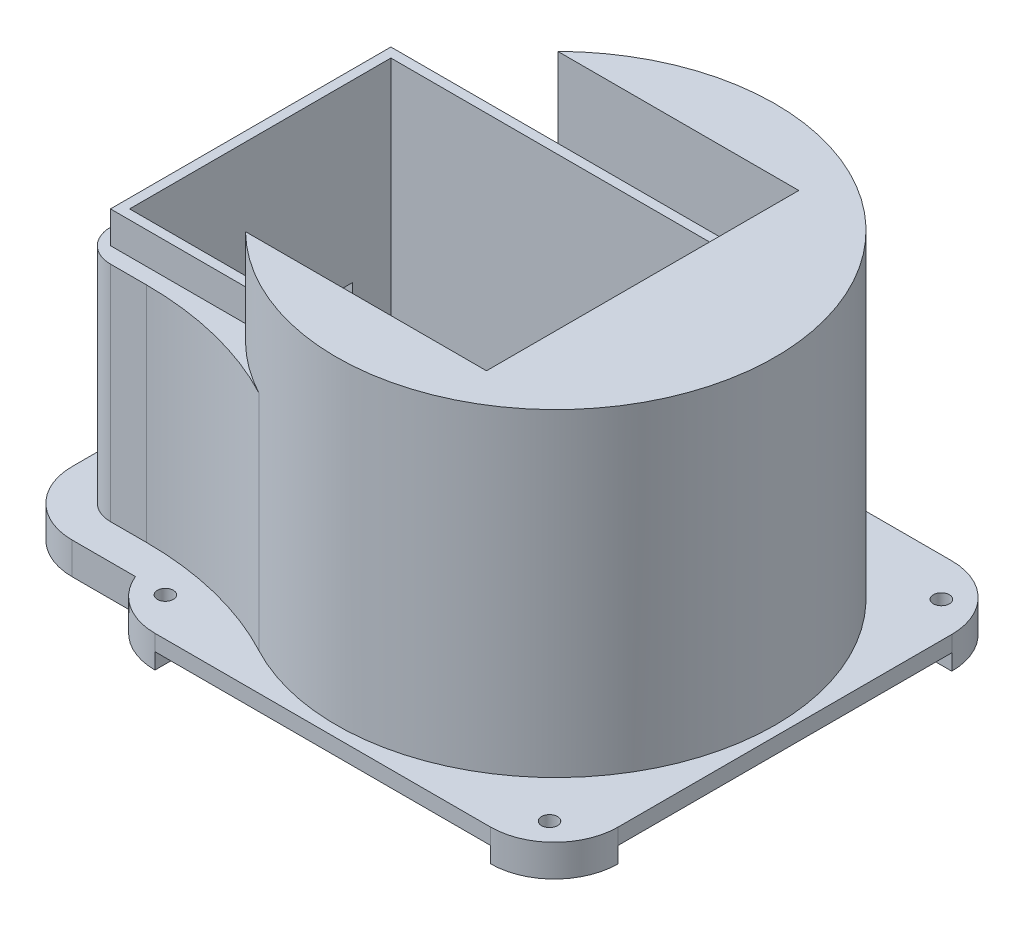
from build123d import *

# Parameters (mm, degrees)
CROQUIS2_W               = 118
CROQUIS2_H               = 88
SALIENTE_EXTRUIR1_DEPTH  = 5
CROQUIS3_W               = 118
CROQUIS3_H               = 88
CROQUIS3_W_2             = 112
CROQUIS3_H_2             = 82
SALIENTE_EXTRUIR2_DEPTH  = 80
CROQUIS4_W               = 150
CROQUIS4_H               = 120
SALIENTE_EXTRUIR3_DEPTH  = 5
CROQUIS7_W               = 60
CROQUIS7_H               = 17
CORTAR_EXTRUIR3_DEPTH    = 5
CROQUIS8_W               = 3
CROQUIS8_H               = 17
SALIENTE_EXTRUIR4_DEPTH  = 4
CROQUIS9_W               = 3
CROQUIS9_H               = 17
SALIENTE_EXTRUIR5_DEPTH  = 7
CROQUIS10_W              = 118
CROQUIS10_H              = 5
SALIENTE_EXTRUIR6_DEPTH  = 5
CROQUIS11_W              = 93
CROQUIS11_H              = 5
SALIENTE_EXTRUIR7_DEPTH  = 5
CROQUIS12_W              = 123
CROQUIS12_H              = 5
SALIENTE_EXTRUIR8_DEPTH  = 5
CROQUIS13_W              = 98
CROQUIS13_H              = 5
SALIENTE_EXTRUIR9_DEPTH  = 5
SALIENTE_EXTRUIR11_DEPTH = 85
CORTAR_EXTRUIR4_DEPTH    = 10
SALIENTE_EXTRUIR12_DEPTH = 70
CROQUIS21_W              = 49
CROQUIS21_H              = 17
CORTAR_EXTRUIR5_DEPTH    = 70
REDONDEO4_R              = 10
REDONDEO5_R              = 100
SALIENTE_EXTRUIR13_DEPTH = 20
CROQUIS23_W              = 143.80914693
CROQUIS23_H              = 144.72077086
CROQUIS23_R              = 24.004265162
SALIENTE_EXTRUIR14_DEPTH = 5
SALIENTE_EXTRUIR15_DEPTH = 5
REDONDEO9_R              = 20
CROQUIS27_W              = 105.325741151
CROQUIS27_H              = 5
CORTAR_EXTRUIR7_DEPTH    = 210.21942266
CROQUIS28_W              = 104.72077086
CROQUIS28_H              = 5
CORTAR_EXTRUIR8_DEPTH    = 143.809145
CROQUIS29_R              = 2.5
CORTAR_EXTRUIR9_DEPTH    = 10
REDONDEO10_R             = 20
CROQUIS30_W              = 82
CROQUIS30_H              = 69.590652645
CORTAR_EXTRUIR10_DEPTH   = 30


with BuildPart() as part:
    # Croquis2 → Saliente-Extruir1 (new body)
    with BuildSketch(Plane(origin=(0, 0, 0), x_dir=(1, 0, 0), z_dir=(0, 1, 0))):
        Rectangle(CROQUIS2_W, CROQUIS2_H)
    extrude(amount=SALIENTE_EXTRUIR1_DEPTH)

    # Croquis3 → Saliente-Extruir2 (add)
    with BuildSketch(Plane(origin=(0, 5, 0), x_dir=(1, 0, 0), z_dir=(0, 1, 0))):
        Rectangle(CROQUIS3_W, CROQUIS3_H)
        Rectangle(CROQUIS3_W_2, CROQUIS3_H_2, mode=Mode.SUBTRACT)
    extrude(amount=SALIENTE_EXTRUIR2_DEPTH)

    # Croquis4 → Saliente-Extruir3 (add)
    with BuildSketch(Plane.XZ):
        Rectangle(CROQUIS4_W, CROQUIS4_H)
    extrude(amount=-SALIENTE_EXTRUIR3_DEPTH)

    # Croquis7 → Cortar-Extruir3 (cut)
    with BuildSketch(Plane.ZY.offset(59)):
        with Locations((-3, 21.5)):
            Rectangle(CROQUIS7_W, CROQUIS7_H)
    extrude(amount=-CORTAR_EXTRUIR3_DEPTH, mode=Mode.SUBTRACT)

    # Croquis8 → Saliente-Extruir4 (add)
    with BuildSketch(Plane.XY.offset(-33)):
        with Locations((-57.5, 21.5)):
            Rectangle(CROQUIS8_W, CROQUIS8_H)
    extrude(amount=SALIENTE_EXTRUIR4_DEPTH)

    # Croquis9 → Saliente-Extruir5 (add)
    with BuildSketch(Plane(origin=(0, 0, 27), x_dir=(-1, 0, 0), z_dir=(0, 0, -1))):
        with Locations((57.5, 21.5)):
            Rectangle(CROQUIS9_W, CROQUIS9_H)
    extrude(amount=SALIENTE_EXTRUIR5_DEPTH)

    # Croquis10 → Saliente-Extruir6 (add)
    with BuildSketch(Plane.XY.offset(44)):
        with Locations((0, 72.5)):
            Rectangle(CROQUIS10_W, CROQUIS10_H)
    extrude(amount=SALIENTE_EXTRUIR6_DEPTH)

    # Croquis11 → Saliente-Extruir7 (add)
    with BuildSketch(Plane(origin=(59, 0, 0), x_dir=(0, 0, -1), z_dir=(1, 0, 0))):
        with Locations((-2.5, 72.5)):
            Rectangle(CROQUIS11_W, CROQUIS11_H)
    extrude(amount=SALIENTE_EXTRUIR7_DEPTH)

    # Croquis12 → Saliente-Extruir8 (add)
    with BuildSketch(Plane(origin=(0, 0, -44), x_dir=(-1, 0, 0), z_dir=(0, 0, -1))):
        with Locations((-2.5, 72.5)):
            Rectangle(CROQUIS12_W, CROQUIS12_H)
    extrude(amount=SALIENTE_EXTRUIR8_DEPTH)

    # Croquis13 → Saliente-Extruir9 (add)
    with BuildSketch(Plane.ZY.offset(59)):
        with Locations((0, 72.5)):
            Rectangle(CROQUIS13_W, CROQUIS13_H)
    extrude(amount=SALIENTE_EXTRUIR9_DEPTH)

    # Croquis16 → Saliente-Extruir11 (add)
    with BuildSketch(Plane(origin=(0, 0, 0), x_dir=(-1, 0, 0), z_dir=(0, -1, 0))):
        with BuildLine():
            Line((-59, 44), (16.214965512, 44))
            ThreePointArc((16.214965512, 44), (-105.589495195, 0), (16.214965512, -44))
            Line((16.214965512, -44), (-59, -44))
            Line((-59, -44), (-59, 44))
        make_face()
    extrude(amount=-SALIENTE_EXTRUIR11_DEPTH)

    # Croquis18 → Cortar-Extruir4 (cut)
    with BuildSketch(Plane(origin=(0, 85, 0), x_dir=(1, 0, 0), z_dir=(0, 1, 0))):
        Polygon((-64, 49), (-8.415102712, 49), (63.361111922, 49), (64, 49), (64, 44), (64, -44), (64, -49), (63.361111922, -49), (-8.415102712, -49), (-64, -49), (-64, -44), (-16.214965512, -44), (59, -44), (59, 44), (-16.214965512, 44), (-64, 44), align=None)
    extrude(amount=-CORTAR_EXTRUIR4_DEPTH, mode=Mode.SUBTRACT)

    # Croquis19 → Saliente-Extruir12 (add)
    with BuildSketch(Plane(origin=(0, 5, 0), x_dir=(1, 0, 0), z_dir=(0, 1, 0))):
        Polygon((-16.214965512, -44), (-59, -44), (-59, 44), (-16.214965512, 44), (3.50341587, 44), (3.50341587, 49), (-8.415102712, 49), (-64, 49), (-64, -49), (-8.415102712, -49), (4.243498443, -49), (4.243498443, -44), align=None)
    extrude(amount=SALIENTE_EXTRUIR12_DEPTH)

    # Croquis21 → Cortar-Extruir5 (cut)
    with BuildSketch(Plane(origin=(-56, 0, 0), x_dir=(0, 0, -1), z_dir=(1, 0, 0))):
        with Locations((4.5, 21.5)):
            Rectangle(CROQUIS21_W, CROQUIS21_H)
    extrude(amount=-CORTAR_EXTRUIR5_DEPTH, mode=Mode.SUBTRACT)

    # Redondeo4
    redondeo4_edges = [part.edges().sort_by_distance(p)[0] for p in [
        (-64, 40, -49),
        (-64, 40, 49),
    ]]
    fillet(redondeo4_edges, radius=REDONDEO4_R)

    # Redondeo5
    redondeo5_edges = [part.edges().sort_by_distance(p)[0] for p in [
        (-11.625579702, 40, -49),
        (-11.625579702, 40, 49),
    ]]
    fillet(redondeo5_edges, radius=REDONDEO5_R)

    # Croquis22 → Saliente-Extruir13 (add)
    with BuildSketch(Plane(origin=(0, 85, 0), x_dir=(1, 0, 0), z_dir=(0, 1, 0))):
        with BuildLine():
            Line((64, -49), (4.315842741, -49))
            Line((4.315842741, -49), (-11.625579493, -49))
            ThreePointArc((-11.625579493, -49), (105.589495048, 0), (-11.625579493, 49))
            Line((-11.625579493, 49), (4.315842741, 49))
            Line((4.315842741, 49), (64, 49))
            Line((64, 49), (64, -49))
        make_face()
    extrude(amount=SALIENTE_EXTRUIR13_DEPTH)

    # Croquis23 → Saliente-Extruir14 (add)
    with BuildSketch(Plane(origin=(0, 0, 0), x_dir=(-1, 0, 0), z_dir=(0, -1, 0))):
        with Locations((-36.740101048, 0)):
            Rectangle(CROQUIS23_W, CROQUIS23_H)
        with Locations((-36.740101048, 0)):
            Circle(CROQUIS23_R, mode=Mode.SUBTRACT)
    extrude(amount=-SALIENTE_EXTRUIR14_DEPTH)

    # Croquis25 → Saliente-Extruir15 (add)
    with BuildSketch(Plane(origin=(0, 0, 0), x_dir=(-1, 0, 0), z_dir=(0, -1, 0))):
        Polygon((35.164472417, -60), (35.164472417, -72.36038543), (-108.644674513, -72.36038543), (-108.644674513, 72.36038543), (35.164472417, 72.36038543), (35.164472417, 60), (75, 60), (75, -60), align=None)
    extrude(amount=SALIENTE_EXTRUIR15_DEPTH)

    # Redondeo9
    # the kernel refuses this fillet: 20 mm, written as the material it takes off along each edge
    with BuildSketch(Plane(origin=(108.644674513, -55, -72.36038543), x_dir=(-1, 0, 0), z_dir=(0, 1, 0)), Plane(origin=(108.644674513, -55, 72.36038543), x_dir=(0, 0, -1), z_dir=(0, 1, 0))) as redondeo9_piece_1:
        with BuildLine():
            CenterArc((REDONDEO9_R, REDONDEO9_R), REDONDEO9_R, 180, 90)
            Line((0, REDONDEO9_R), (-REDONDEO9_R * 0.02, REDONDEO9_R))
            Line((-REDONDEO9_R * 0.02, REDONDEO9_R), (-REDONDEO9_R * 0.02, -REDONDEO9_R * 0.02))
            Line((-REDONDEO9_R * 0.02, -REDONDEO9_R * 0.02), (REDONDEO9_R, -REDONDEO9_R * 0.02))
            Line((REDONDEO9_R, -REDONDEO9_R * 0.02), (REDONDEO9_R, 0))
        make_face()
    extrude(amount=110, mode=Mode.SUBTRACT)
    with BuildSketch(Plane(origin=(-35.164472417, -51.20851445, 72.36038543), x_dir=(1, 0, 0), z_dir=(0, 1, 0))) as redondeo9_piece_2:
        with BuildLine():
            CenterArc((18.48340578, 20), REDONDEO9_R, 202.456427621, 67.543572379)
            Line((0, 12.36038543), (-0.369668116, 12.207593139))
            ThreePointArc((-0.369668116, 12.207593139), (-0.4, 6.180192715), (-0.4, 0))
            Line((-0.4, 0), (0, -0.4))
            Line((0, -0.4), (18.48340578, -0.4))
            Line((18.48340578, -0.4), (18.48340578, 0))
        make_face()
    extrude(amount=102.417028899, mode=Mode.SUBTRACT)
    with BuildSketch(Plane(origin=(-35.164472417, -51.20851445, -72.36038543), x_dir=(0, 0, 1), z_dir=(0, 1, 0))) as redondeo9_piece_3:
        with BuildLine():
            CenterArc((20, 18.48340578), REDONDEO9_R, 180, 67.543572379)
            Line((0, 18.48340578), (-0.4, 18.48340578))
            Line((-0.4, 18.48340578), (-0.4, 0))
            Line((-0.4, 0), (0, -0.4))
            ThreePointArc((0, -0.4), (6.180192715, -0.4), (12.207593139, -0.369668116))
            Line((12.207593139, -0.369668116), (12.36038543, 0))
        make_face()
    extrude(amount=102.417028899, mode=Mode.SUBTRACT)

    # Croquis27 → Cortar-Extruir7 (cut, through all)
    with BuildSketch(Plane(origin=(0, 0, -72.36038543), x_dir=(-1, 0, 0), z_dir=(0, 0, -1))):
        with Locations((-35.981803938, -2.5)):
            Rectangle(CROQUIS27_W, CROQUIS27_H)
    extrude(amount=-CORTAR_EXTRUIR7_DEPTH, mode=Mode.SUBTRACT)

    # Croquis28 → Cortar-Extruir8 (cut)
    with BuildSketch(Plane(origin=(108.644674513, 0, 0), x_dir=(0, 0, -1), z_dir=(1, 0, 0))):
        with Locations((0, -2.5)):
            Rectangle(CROQUIS28_W, CROQUIS28_H)
    extrude(amount=-CORTAR_EXTRUIR8_DEPTH, mode=Mode.SUBTRACT)

    # Croquis29 → Cortar-Extruir9 (cut)
    with BuildSketch(Plane(origin=(0, -5, 0), x_dir=(-1, 0, 0), z_dir=(0, -1, 0))):
        with Locations(Location((-96.256800969, -61.48231173, 0), (0, 0, 90))):
            Circle(CROQUIS29_R)
        with Locations(Location((-97.464115668, 60.274997031, 0), (0, 0, 90))):
            Circle(CROQUIS29_R)
        with Locations(Location((24.293193094, 61.48231173, 0), (0, 0, 90))):
            Circle(CROQUIS29_R)
        with Locations(Location((25.500507793, -60.274997031, 0), (0, 0, 90))):
            Circle(CROQUIS29_R)
    extrude(amount=-CORTAR_EXTRUIR9_DEPTH, mode=Mode.SUBTRACT)

    # Redondeo10
    redondeo10_edges = [part.edges().sort_by_distance(p)[0] for p in [
        (-75, 0, -60),
        (-75, 0, 60),
    ]]
    fillet(redondeo10_edges, radius=REDONDEO10_R)

    # Croquis30 → Cortar-Extruir10 (cut)
    with BuildSketch(Plane.ZY.offset(-56)):
        with Locations((0, 39.795326323)):
            Rectangle(CROQUIS30_W, CROQUIS30_H)
    extrude(amount=-CORTAR_EXTRUIR10_DEPTH, mode=Mode.SUBTRACT)


solid = part.part
